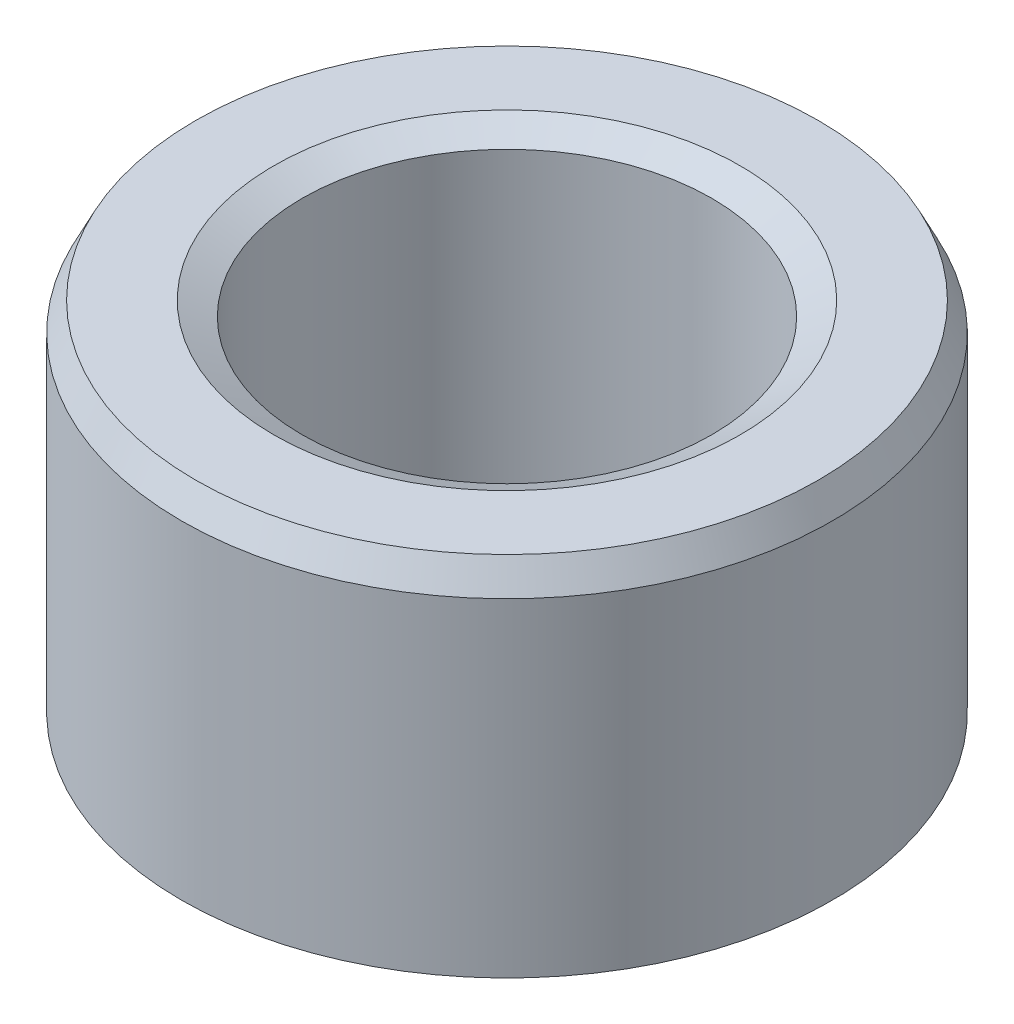
from build123d import *
from OCP.BRepFilletAPI import BRepFilletAPI_MakeChamfer

# Parameters (mm, degrees)
SKETCH1_R           = 10
BOSS_EXTRUDE1_DEPTH = 11.393226221
SKETCH2_R           = 6.293158774
CUT_EXTRUDE1_DEPTH  = 19.160550755
CHAMFER1_SIZE       = 0.870278672
CHAMFER1_SIZE2      = 0.432113114


with BuildPart() as part:
    # Sketch1 → Boss-Extrude1 (new body)
    with BuildSketch(Plane(origin=(0, 0, 0), x_dir=(1, 0, 0), z_dir=(0, 1, 0))):
        Circle(SKETCH1_R)
    extrude(amount=BOSS_EXTRUDE1_DEPTH)

    # Sketch2 → Cut-Extrude1 (cut, through all)
    with BuildSketch(Plane(origin=(0, 0, 0), x_dir=(1, 0, 0), z_dir=(0, 1, 0))):
        Circle(SKETCH2_R)
    extrude(amount=CUT_EXTRUDE1_DEPTH, mode=Mode.SUBTRACT)

    # Chamfer1: one chamfer whose edges measure the first distance from different faces: ONE call of the kernel's chamfer builder (chamfer() names one face for all edges)
    chamfer1_edges_1 = [part.edges().sort_by_distance(p)[0] for p in [
        (-6.293158774, 11.393226221, 0),
    ]]
    chamfer1_side_1 = [part.faces().sort_by_distance(p)[0] for p in [
        (-9.717157288, 11.393226221, 0),
    ]]
    chamfer1_edges_2 = [part.edges().sort_by_distance(p)[0] for p in [
        (-6.293158774, 0, 0),
    ]]
    chamfer1_side_2 = [part.faces().sort_by_distance(p)[0] for p in [
        (-6.293158774, 5.696613111, 0),
    ]]
    chamfer1_edges_3 = [part.edges().sort_by_distance(p)[0] for p in [
        (-10, 0, 0),
    ]]
    chamfer1_side_3 = [part.faces().sort_by_distance(p)[0] for p in [
        (-9.717157288, 0, 0),
    ]]
    chamfer1_edges_4 = [part.edges().sort_by_distance(p)[0] for p in [
        (-10, 11.393226221, 0),
    ]]
    chamfer1_side_4 = [part.faces().sort_by_distance(p)[0] for p in [
        (-10, 5.696613111, 0),
    ]]
    chamfer1 = BRepFilletAPI_MakeChamfer(part.part.solid().wrapped)
    for e in chamfer1_edges_1:
        chamfer1.Add(CHAMFER1_SIZE, CHAMFER1_SIZE2, e.wrapped, chamfer1_side_1[0].wrapped)  # the first distance lies on this face
    for e in chamfer1_edges_2:
        chamfer1.Add(CHAMFER1_SIZE, CHAMFER1_SIZE2, e.wrapped, chamfer1_side_2[0].wrapped)  # the first distance lies on this face
    for e in chamfer1_edges_3:
        chamfer1.Add(CHAMFER1_SIZE, CHAMFER1_SIZE2, e.wrapped, chamfer1_side_3[0].wrapped)  # the first distance lies on this face
    for e in chamfer1_edges_4:
        chamfer1.Add(CHAMFER1_SIZE, CHAMFER1_SIZE2, e.wrapped, chamfer1_side_4[0].wrapped)  # the first distance lies on this face
    add(Compound.cast(chamfer1.Shape()), mode=Mode.REPLACE)


solid = part.part
